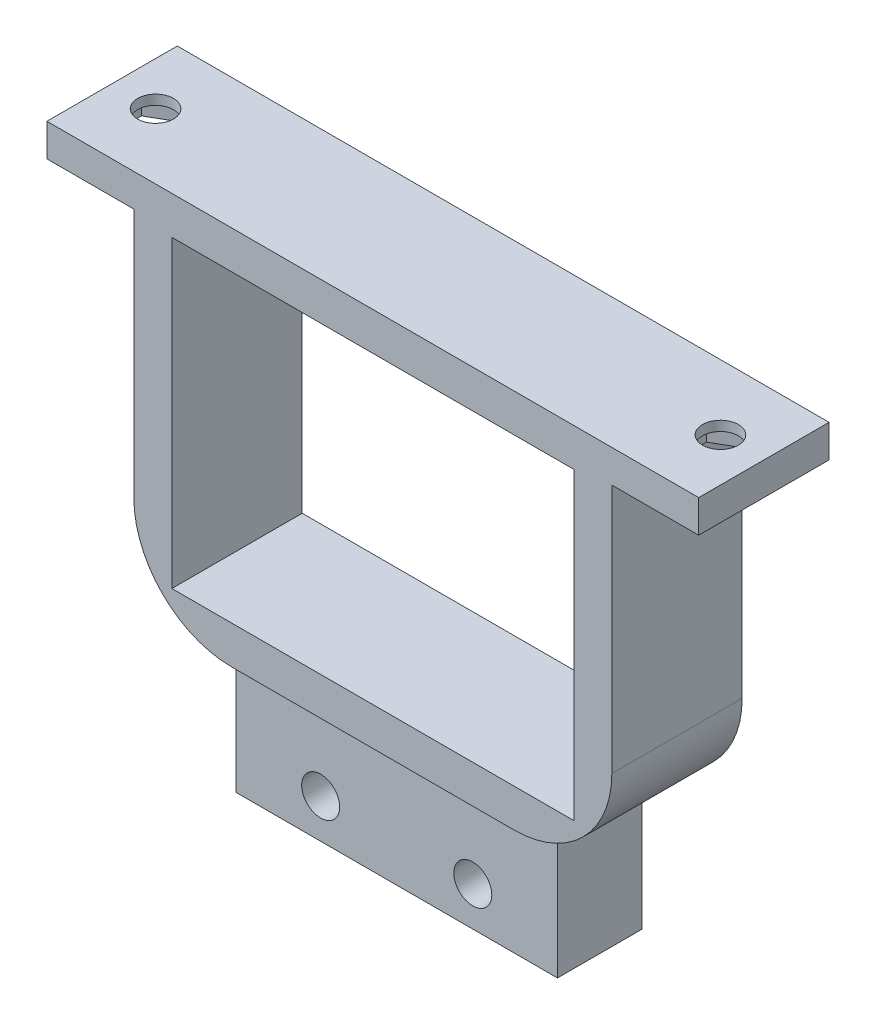
from build123d import *

# Parameters (mm, degrees)
SKETCH1_W                = 37
SKETCH1_H                = 28
SKETCH1_R                = 1.75
BOSS_EXTRUDE1_DEPTH      = 7.8
BOSS_EXTRUDE2_DEPTH      = 10
BOSS_EXTRUDE2_DEPTH_BACK = 2
SKETCH1_3_W              = 44
SKETCH1_3_H              = 35
SKETCH1_3_W_2            = 37
SKETCH1_3_H_2            = 28
SKETCH1_3_W_3            = 8
SKETCH1_3_H_3            = 3
FILLET1_R                = 9
CUT_EXTRUDE1_DEPTH       = 2.1
HOLE1_D                  = 3.3


with BuildPart() as part:
    # Sketch1 → Boss-Extrude1 (new body)
    with BuildSketch(Plane.XY):
        Polygon((-7.2, 0), (0, 0), (0, 32), (8, 32), (8, 35), (-52, 35), (-52, 32), (-44, 32), (-44, 0), (-36.8, 0), (-36.8, -12), (-7.2, -12), align=None)
        with Locations((-22, 17.5)):
            Rectangle(SKETCH1_W, SKETCH1_H, mode=Mode.SUBTRACT)
        with Locations((-15, -8.4)):
            Circle(SKETCH1_R, mode=Mode.SUBTRACT)
        with Locations((-29, -8.4)):
            Circle(SKETCH1_R, mode=Mode.SUBTRACT)
    extrude(amount=BOSS_EXTRUDE1_DEPTH)

    # Sketch1<3> → Boss-Extrude2 (add, two sides: drawn at the far end of the back side and taken through both)
    # profile 1 of 3: a face of its own
    with BuildSketch(Plane.XY.offset(-BOSS_EXTRUDE2_DEPTH_BACK)):
        with Locations((-22, 17.5)):
            Rectangle(SKETCH1_3_W, SKETCH1_3_H)
        with Locations((-22, 17.5)):
            Rectangle(SKETCH1_3_W_2, SKETCH1_3_H_2, mode=Mode.SUBTRACT)
    # profile 2 of 3: a face of its own
    with BuildSketch(Plane.XY.offset(-BOSS_EXTRUDE2_DEPTH_BACK)):
        with Locations((4, 33.5)):
            Rectangle(SKETCH1_3_W_3, SKETCH1_3_H_3)
    # profile 3 of 3: a face of its own
    with BuildSketch(Plane.XY.offset(-BOSS_EXTRUDE2_DEPTH_BACK)):
        with Locations((-48, 33.5)):
            Rectangle(SKETCH1_3_W_3, SKETCH1_3_H_3)
    extrude(amount=BOSS_EXTRUDE2_DEPTH + BOSS_EXTRUDE2_DEPTH_BACK)

    # Fillet1
    # the kernel refuses this fillet: 9 mm, written as the material it takes off along each edge
    with BuildSketch(Plane(origin=(0, 0, -24.5), x_dir=(-1, 0, 0), z_dir=(0, 0, 1))) as fillet1_piece_1_section:
        with BuildLine():
            CenterArc((FILLET1_R, -FILLET1_R), FILLET1_R, 90, 90)
            Line((0, -FILLET1_R), (0, 0))
            Line((0, 0), (FILLET1_R, 0))
        make_face()
    fillet1_piece_1 = extrude(amount=57, mode=Mode.PRIVATE)
    fillet1_piece_1 = split(fillet1_piece_1, bisect_by=Plane(origin=(-7.2, -0.053721548, -12.25), z_dir=(-1, 0, 0)), keep=Keep.TOP, mode=Mode.PRIVATE)
    fillet1_piece_1 = split(fillet1_piece_1, bisect_by=Plane(origin=(-7.986757567, -0.053721548, 0), z_dir=(0, 0, -1)), keep=Keep.TOP, mode=Mode.PRIVATE)
    add(fillet1_piece_1, mode=Mode.SUBTRACT)
    with BuildSketch(Plane(origin=(0, 0, -24.5), x_dir=(-1, 0, 0), z_dir=(0, 0, 1))) as fillet1_piece_2_section:
        with BuildLine():
            CenterArc((FILLET1_R, -FILLET1_R), FILLET1_R, 90, 90)
            Line((0, -FILLET1_R), (0, 0))
            Line((0, 0), (FILLET1_R, 0))
        make_face()
    fillet1_piece_2 = extrude(amount=57, mode=Mode.PRIVATE)
    fillet1_piece_2 = split(fillet1_piece_2, bisect_by=Plane(origin=(-7.2, 2.082298627, -12.25), z_dir=(1, 0, 0)), keep=Keep.TOP, mode=Mode.PRIVATE)
    fillet1_piece_2 = split(fillet1_piece_2, bisect_by=Plane(origin=(-1.910273674, 2.082298627, 0), z_dir=(0, 0, -1)), keep=Keep.TOP, mode=Mode.PRIVATE)
    add(fillet1_piece_2, mode=Mode.SUBTRACT)
    with BuildSketch(Plane(origin=(0, 0, -24.5), x_dir=(-1, 0, 0), z_dir=(0, 0, 1))) as fillet1_piece_3_section:
        with BuildLine():
            CenterArc((FILLET1_R, -FILLET1_R), FILLET1_R, 90, 90)
            Line((0, -FILLET1_R), (0, 0))
            Line((0, 0), (FILLET1_R, 0))
        make_face()
    fillet1_piece_3 = extrude(amount=57, mode=Mode.PRIVATE)
    fillet1_piece_3 = split(fillet1_piece_3, bisect_by=Plane(origin=(-7.2, 2.082298627, 3.9), z_dir=(1, 0, 0)), keep=Keep.TOP, mode=Mode.PRIVATE)
    fillet1_piece_3 = split(fillet1_piece_3, bisect_by=Plane(origin=(-1.910273674, 2.082298627, 7.8), z_dir=(0, 0, -1)), keep=Keep.TOP, mode=Mode.PRIVATE)
    fillet1_piece_3 = split(fillet1_piece_3, bisect_by=Plane(origin=(-1.910273674, 2.082298627, 0), z_dir=(0, 0, 1)), keep=Keep.TOP, mode=Mode.PRIVATE)
    add(fillet1_piece_3, mode=Mode.SUBTRACT)
    with BuildSketch(Plane(origin=(0, 0, -24.5), x_dir=(-1, 0, 0), z_dir=(0, 0, 1))) as fillet1_piece_4_section:
        with BuildLine():
            CenterArc((FILLET1_R, -FILLET1_R), FILLET1_R, 90, 90)
            Line((0, -FILLET1_R), (0, 0))
            Line((0, 0), (FILLET1_R, 0))
        make_face()
    fillet1_piece_4 = extrude(amount=57, mode=Mode.PRIVATE)
    fillet1_piece_4 = split(fillet1_piece_4, bisect_by=Plane(origin=(-7.2, -0.053721548, 20.15), z_dir=(-1, 0, 0)), keep=Keep.TOP, mode=Mode.PRIVATE)
    fillet1_piece_4 = split(fillet1_piece_4, bisect_by=Plane(origin=(-7.986757567, -0.053721548, 7.8), z_dir=(0, 0, 1)), keep=Keep.TOP, mode=Mode.PRIVATE)
    add(fillet1_piece_4, mode=Mode.SUBTRACT)
    with BuildSketch(Plane(origin=(0, 0, -24.5), x_dir=(-1, 0, 0), z_dir=(0, 0, 1))) as fillet1_piece_5_section:
        with BuildLine():
            CenterArc((FILLET1_R, -FILLET1_R), FILLET1_R, 90, 90)
            Line((0, -FILLET1_R), (0, 0))
            Line((0, 0), (FILLET1_R, 0))
        make_face()
    fillet1_piece_5 = extrude(amount=57, mode=Mode.PRIVATE)
    fillet1_piece_5 = split(fillet1_piece_5, bisect_by=Plane(origin=(-7.2, 2.082298627, 20.15), z_dir=(1, 0, 0)), keep=Keep.TOP, mode=Mode.PRIVATE)
    fillet1_piece_5 = split(fillet1_piece_5, bisect_by=Plane(origin=(-1.910273674, 2.082298627, 7.8), z_dir=(0, 0, 1)), keep=Keep.TOP, mode=Mode.PRIVATE)
    add(fillet1_piece_5, mode=Mode.SUBTRACT)
    with BuildSketch(Plane(origin=(-44, 0, 32.5), x_dir=(1, 0, 0), z_dir=(0, 0, -1))) as fillet1_piece_6_section:
        with BuildLine():
            CenterArc((FILLET1_R, -FILLET1_R), FILLET1_R, 90, 90)
            Line((0, -FILLET1_R), (0, 0))
            Line((0, 0), (FILLET1_R, 0))
        make_face()
    fillet1_piece_6 = extrude(amount=57, mode=Mode.PRIVATE)
    fillet1_piece_6 = split(fillet1_piece_6, bisect_by=Plane(origin=(-36.013242433, -0.053721548, 7.8), z_dir=(0, 0, 1)), keep=Keep.TOP, mode=Mode.PRIVATE)
    fillet1_piece_6 = split(fillet1_piece_6, bisect_by=Plane(origin=(-36.8, -0.053721548, 20.15), z_dir=(1, 0, 0)), keep=Keep.TOP, mode=Mode.PRIVATE)
    add(fillet1_piece_6, mode=Mode.SUBTRACT)
    with BuildSketch(Plane(origin=(-44, 0, 32.5), x_dir=(1, 0, 0), z_dir=(0, 0, -1))) as fillet1_piece_7_section:
        with BuildLine():
            CenterArc((FILLET1_R, -FILLET1_R), FILLET1_R, 90, 90)
            Line((0, -FILLET1_R), (0, 0))
            Line((0, 0), (FILLET1_R, 0))
        make_face()
    fillet1_piece_7 = extrude(amount=57, mode=Mode.PRIVATE)
    fillet1_piece_7 = split(fillet1_piece_7, bisect_by=Plane(origin=(-42.089726326, 2.082298627, 7.8), z_dir=(0, 0, 1)), keep=Keep.TOP, mode=Mode.PRIVATE)
    fillet1_piece_7 = split(fillet1_piece_7, bisect_by=Plane(origin=(-36.8, 2.082298627, 20.15), z_dir=(-1, 0, 0)), keep=Keep.TOP, mode=Mode.PRIVATE)
    add(fillet1_piece_7, mode=Mode.SUBTRACT)
    with BuildSketch(Plane(origin=(-44, 0, 32.5), x_dir=(1, 0, 0), z_dir=(0, 0, -1))) as fillet1_piece_8_section:
        with BuildLine():
            CenterArc((FILLET1_R, -FILLET1_R), FILLET1_R, 90, 90)
            Line((0, -FILLET1_R), (0, 0))
            Line((0, 0), (FILLET1_R, 0))
        make_face()
    fillet1_piece_8 = extrude(amount=57, mode=Mode.PRIVATE)
    fillet1_piece_8 = split(fillet1_piece_8, bisect_by=Plane(origin=(-42.089726326, 2.082298627, 7.8), z_dir=(0, 0, -1)), keep=Keep.TOP, mode=Mode.PRIVATE)
    fillet1_piece_8 = split(fillet1_piece_8, bisect_by=Plane(origin=(-36.8, 2.082298627, 3.9), z_dir=(-1, 0, 0)), keep=Keep.TOP, mode=Mode.PRIVATE)
    fillet1_piece_8 = split(fillet1_piece_8, bisect_by=Plane(origin=(-42.089726326, 2.082298627, 0), z_dir=(0, 0, 1)), keep=Keep.TOP, mode=Mode.PRIVATE)
    add(fillet1_piece_8, mode=Mode.SUBTRACT)
    with BuildSketch(Plane(origin=(-44, 0, 32.5), x_dir=(1, 0, 0), z_dir=(0, 0, -1))) as fillet1_piece_9_section:
        with BuildLine():
            CenterArc((FILLET1_R, -FILLET1_R), FILLET1_R, 90, 90)
            Line((0, -FILLET1_R), (0, 0))
            Line((0, 0), (FILLET1_R, 0))
        make_face()
    fillet1_piece_9 = extrude(amount=57, mode=Mode.PRIVATE)
    fillet1_piece_9 = split(fillet1_piece_9, bisect_by=Plane(origin=(-36.8, -0.053721548, -12.25), z_dir=(1, 0, 0)), keep=Keep.TOP, mode=Mode.PRIVATE)
    fillet1_piece_9 = split(fillet1_piece_9, bisect_by=Plane(origin=(-36.013242433, -0.053721548, 0), z_dir=(0, 0, -1)), keep=Keep.TOP, mode=Mode.PRIVATE)
    add(fillet1_piece_9, mode=Mode.SUBTRACT)
    with BuildSketch(Plane(origin=(-44, 0, 32.5), x_dir=(1, 0, 0), z_dir=(0, 0, -1))) as fillet1_piece_10_section:
        with BuildLine():
            CenterArc((FILLET1_R, -FILLET1_R), FILLET1_R, 90, 90)
            Line((0, -FILLET1_R), (0, 0))
            Line((0, 0), (FILLET1_R, 0))
        make_face()
    fillet1_piece_10 = extrude(amount=57, mode=Mode.PRIVATE)
    fillet1_piece_10 = split(fillet1_piece_10, bisect_by=Plane(origin=(-36.8, 2.082298627, -12.25), z_dir=(-1, 0, 0)), keep=Keep.TOP, mode=Mode.PRIVATE)
    fillet1_piece_10 = split(fillet1_piece_10, bisect_by=Plane(origin=(-42.089726326, 2.082298627, 0), z_dir=(0, 0, -1)), keep=Keep.TOP, mode=Mode.PRIVATE)
    add(fillet1_piece_10, mode=Mode.SUBTRACT)

    # Sketch2 → Cut-Extrude1 (cut)
    with BuildSketch(Plane.XZ.offset(-32)):
        Polygon((-48, 0.449295844), (-44.925, 2.224647922), (-44.925, 5.775352078), (-48, 7.550704156), (-51.075, 5.775352078), (-51.075, 2.224647922), align=None)
        Polygon((0.925, 5.775352078), (0.925, 2.224647922), (4, 0.449295844), (7.075, 2.224647922), (7.075, 5.775352078), (4, 7.550704156), align=None)
    extrude(amount=-CUT_EXTRUDE1_DEPTH, mode=Mode.SUBTRACT)

    # Hole1 (through all)
    with Locations(Plane(origin=(-48, 32, 4), x_dir=(-1, 0, 0), z_dir=(0, -1, 0))):
        with Locations((0, 0), (-52, 0)):
            Hole(HOLE1_D / 2)


solid = part.part
